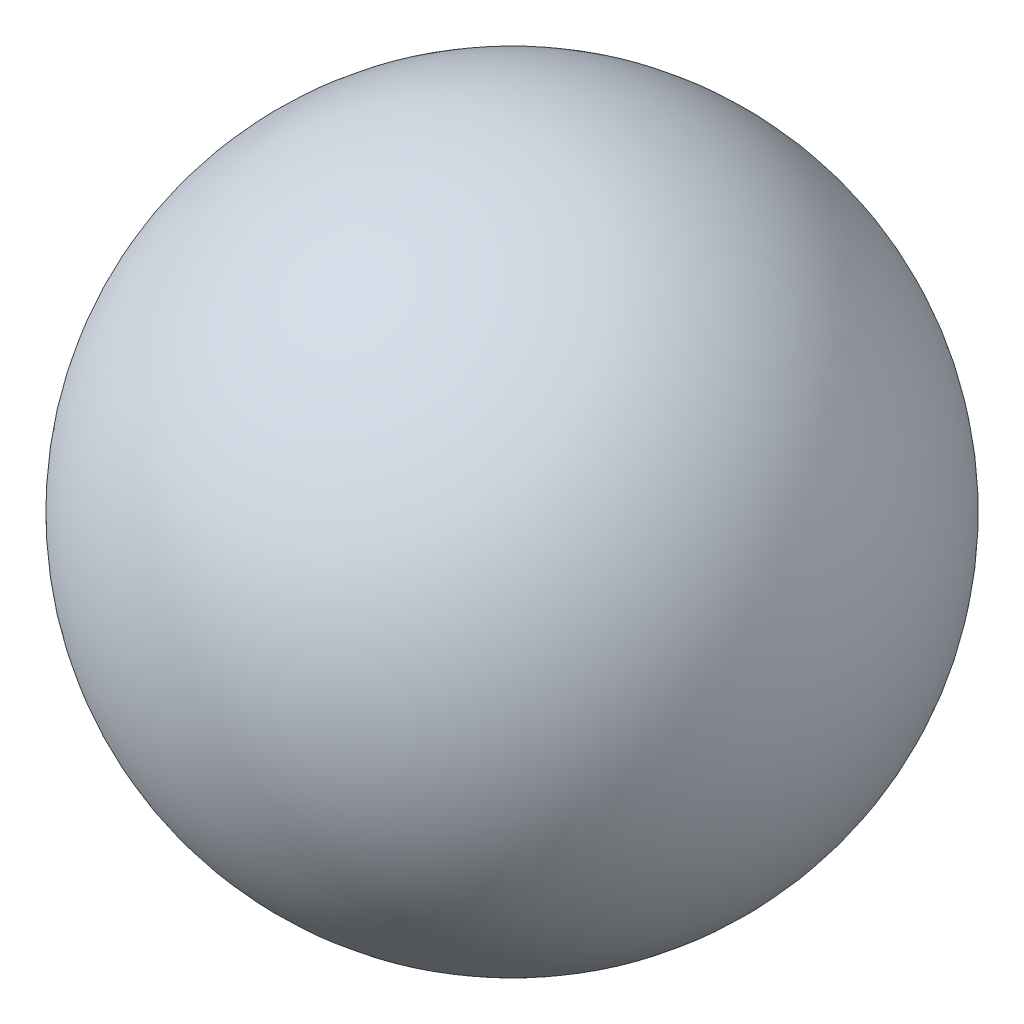
from build123d import *


with BuildPart() as part:
    # Sketch6 → Revolve5 (revolve)
    with BuildSketch(Plane.XY):
        with BuildLine():
            ThreePointArc((2, 0), (1.414213562, 1.414213562), (0, 2))
            Line((0, 2), (0, -2))
            ThreePointArc((0, -2), (1.414213562, -1.414213562), (2, 0))
        make_face()
    revolve(axis=Axis((0, 2, 0), (0, -1, 0)))


solid = part.part
